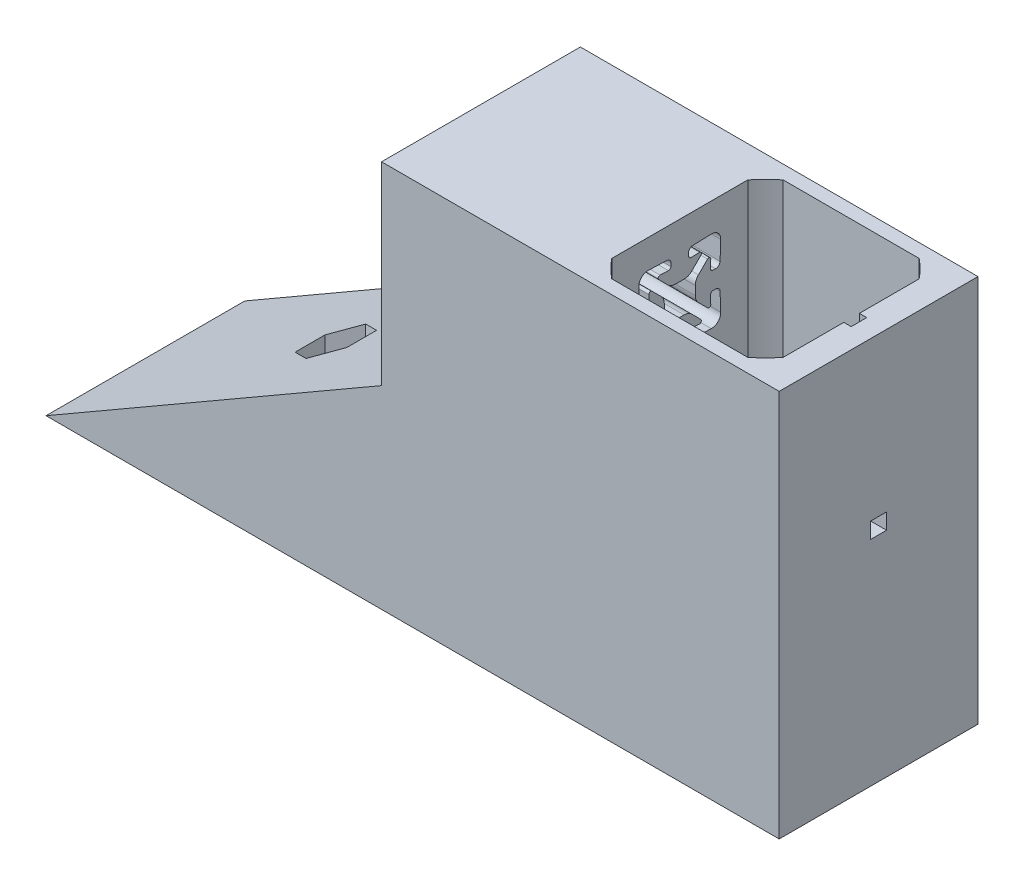
from build123d import *

# Parameters (mm, degrees)
SKETCH1_W           = 35
SKETCH1_H           = 50
SKETCH1_W_2         = 62.5
BOSS_EXTRUDE1_DEPTH = 50
BOSS_EXTRUDE2_DEPTH = 50
CUT_EXTRUDE1_DEPTH  = 81
BOSS_EXTRUDE3_DEPTH = 50.006
SKETCH5_W           = 4
SKETCH5_H           = 4
CUT_EXTRUDE2_DEPTH  = 30
BOSS_EXTRUDE4_DEPTH = 50


with BuildPart() as part:
    # Sketch1 → Boss-Extrude1 (new body)
    # profile 1 of 2: a face of its own
    with BuildSketch(Plane.YZ):
        with Locations((80, 305)):
            Rectangle(SKETCH1_W, SKETCH1_H)
        with BuildLine():
            Line((76.1, 303.897755224), (76.1, 306.102244776))
            ThreePointArc((76.1, 306.102244776), (75.894474738, 307.135490044), (75.309188309, 308.011433085))
            Line((75.309188309, 308.011433085), (73.008308049, 310.312313346))
            ThreePointArc((73.008308049, 310.312313346), (72.488454457, 310.411010634), (72.206097787, 309.963502397))
            Line((72.206097787, 309.963502397), (72.280053987, 307.845673932))
            ThreePointArc((72.280053987, 307.845673932), (72.119231712, 307.415535218), (71.701359189, 307.225099738))
            Line((71.701359189, 307.225099738), (71.00178561, 307.20067009))
            ThreePointArc((71.00178561, 307.20067009), (70.213197967, 307.495510928), (69.864066254, 308.261610554))
            Line((69.864066254, 308.261610554), (69.701401098, 312.919731158))
            ThreePointArc((69.701401098, 312.919731158), (70.373654403, 314.626345597), (72.080268842, 315.298598902))
            Line((72.080268842, 315.298598902), (76.738389446, 315.135933746))
            ThreePointArc((76.738389446, 315.135933746), (77.504489072, 314.786802033), (77.79932991, 313.99821439))
            Line((77.79932991, 313.99821439), (77.774900262, 313.298640811))
            ThreePointArc((77.774900262, 313.298640811), (77.584464782, 312.880768288), (77.154326068, 312.719946013))
            Line((77.154326068, 312.719946013), (75.036497603, 312.793902213))
            ThreePointArc((75.036497603, 312.793902213), (74.588989366, 312.511545543), (74.687686654, 311.991691951))
            Line((74.687686654, 311.991691951), (76.988566915, 309.690811691))
            ThreePointArc((76.988566915, 309.690811691), (77.864509956, 309.105525262), (78.897755224, 308.9))
            Line((78.897755224, 308.9), (81.102244776, 308.9))
            ThreePointArc((81.102244776, 308.9), (82.135490044, 309.105525262), (83.011433085, 309.690811691))
            Line((83.011433085, 309.690811691), (85.312313346, 311.991691951))
            ThreePointArc((85.312313346, 311.991691951), (85.411010634, 312.511545543), (84.963502397, 312.793902213))
            Line((84.963502397, 312.793902213), (82.845673932, 312.719946013))
            ThreePointArc((82.845673932, 312.719946013), (82.415535218, 312.880768288), (82.225099738, 313.298640811))
            Line((82.225099738, 313.298640811), (82.20067009, 313.99821439))
            ThreePointArc((82.20067009, 313.99821439), (82.495510928, 314.786802033), (83.261610554, 315.135933746))
            Line((83.261610554, 315.135933746), (87.919731158, 315.298598902))
            ThreePointArc((87.919731158, 315.298598902), (89.626345597, 314.626345597), (90.298598902, 312.919731158))
            Line((90.298598902, 312.919731158), (90.135933746, 308.261610554))
            ThreePointArc((90.135933746, 308.261610554), (89.786802033, 307.495510928), (88.99821439, 307.20067009))
            Line((88.99821439, 307.20067009), (88.298640811, 307.225099738))
            ThreePointArc((88.298640811, 307.225099738), (87.880768288, 307.415535218), (87.719946013, 307.845673932))
            Line((87.719946013, 307.845673932), (87.793902213, 309.963502397))
            ThreePointArc((87.793902213, 309.963502397), (87.511545543, 310.411010634), (86.991691951, 310.312313346))
            Line((86.991691951, 310.312313346), (84.690811691, 308.011433085))
            ThreePointArc((84.690811691, 308.011433085), (84.105525262, 307.135490044), (83.9, 306.102244776))
            Line((83.9, 306.102244776), (83.9, 303.897755224))
            ThreePointArc((83.9, 303.897755224), (84.105525262, 302.864509956), (84.690811691, 301.988566915))
            Line((84.690811691, 301.988566915), (86.991691951, 299.687686654))
            ThreePointArc((86.991691951, 299.687686654), (87.511545543, 299.588989366), (87.793902213, 300.036497603))
            Line((87.793902213, 300.036497603), (87.719946013, 302.154326068))
            ThreePointArc((87.719946013, 302.154326068), (87.880768288, 302.584464782), (88.298640811, 302.774900262))
            Line((88.298640811, 302.774900262), (88.99821439, 302.79932991))
            ThreePointArc((88.99821439, 302.79932991), (89.786802033, 302.504489072), (90.135933746, 301.738389446))
            Line((90.135933746, 301.738389446), (90.298598902, 297.080268842))
            ThreePointArc((90.298598902, 297.080268842), (89.626345597, 295.373654403), (87.919731158, 294.701401098))
            Line((87.919731158, 294.701401098), (83.261610554, 294.864066254))
            ThreePointArc((83.261610554, 294.864066254), (82.495510928, 295.213197967), (82.20067009, 296.00178561))
            Line((82.20067009, 296.00178561), (82.225099738, 296.701359189))
            ThreePointArc((82.225099738, 296.701359189), (82.415535218, 297.119231712), (82.845673932, 297.280053987))
            Line((82.845673932, 297.280053987), (84.963502397, 297.206097787))
            ThreePointArc((84.963502397, 297.206097787), (85.411010634, 297.488454457), (85.312313346, 298.008308049))
            Line((85.312313346, 298.008308049), (83.011433085, 300.309188309))
            ThreePointArc((83.011433085, 300.309188309), (82.135490044, 300.894474738), (81.102244776, 301.1))
            Line((81.102244776, 301.1), (78.897755224, 301.1))
            ThreePointArc((78.897755224, 301.1), (77.864509956, 300.894474738), (76.988566915, 300.309188309))
            Line((76.988566915, 300.309188309), (74.687686654, 298.008308049))
            ThreePointArc((74.687686654, 298.008308049), (74.588989366, 297.488454457), (75.036497603, 297.206097787))
            Line((75.036497603, 297.206097787), (77.154326068, 297.280053987))
            ThreePointArc((77.154326068, 297.280053987), (77.584464782, 297.119231712), (77.774900262, 296.701359189))
            Line((77.774900262, 296.701359189), (77.79932991, 296.00178561))
            ThreePointArc((77.79932991, 296.00178561), (77.504489072, 295.213197967), (76.738389446, 294.864066254))
            Line((76.738389446, 294.864066254), (72.080268842, 294.701401098))
            ThreePointArc((72.080268842, 294.701401098), (70.373654403, 295.373654403), (69.701401098, 297.080268842))
            Line((69.701401098, 297.080268842), (69.864066254, 301.738389446))
            ThreePointArc((69.864066254, 301.738389446), (70.213197967, 302.504489072), (71.00178561, 302.79932991))
            Line((71.00178561, 302.79932991), (71.701359189, 302.774900262))
            ThreePointArc((71.701359189, 302.774900262), (72.119231712, 302.584464782), (72.280053987, 302.154326068))
            Line((72.280053987, 302.154326068), (72.206097787, 300.036497603))
            ThreePointArc((72.206097787, 300.036497603), (72.488454457, 299.588989366), (73.008308049, 299.687686654))
            Line((73.008308049, 299.687686654), (75.309188309, 301.988566915))
            ThreePointArc((75.309188309, 301.988566915), (75.894474738, 302.864509956), (76.1, 303.897755224))
        make_face(mode=Mode.SUBTRACT)
    # profile 2 of 2: a face of its own
    with BuildSketch(Plane.YZ):
        with Locations((31.25, 305)):
            Rectangle(SKETCH1_W_2, SKETCH1_H)
    extrude(amount=-BOSS_EXTRUDE1_DEPTH)

    # Sketch2 → Boss-Extrude2 (add)
    with BuildSketch(Plane(origin=(0, 0, 280), x_dir=(1, 0, 0), z_dir=(0, 0, -1))):
        Polygon((-50, -48.75), (-134.386033469, 0), (-50, 0), align=None)
    extrude(amount=-BOSS_EXTRUDE2_DEPTH)

    # Sketch3 → Cut-Extrude1 (cut)
    with BuildSketch(Plane(origin=(0, 97.5, 0), x_dir=(-1, 0, 0), z_dir=(0, 1, 0))):
        Polygon((67.990381057, 308.75), (61.495190528, 312.5), (55, 308.75), (55, 301.25), (61.495190528, 297.5), (67.990381057, 301.25), align=None)
        Polygon((92.990381057, 308.75), (86.495190528, 312.5), (80, 308.75), (80, 301.25), (86.495190528, 297.5), (92.990381057, 301.25), align=None)
    extrude(amount=-CUT_EXTRUDE1_DEPTH, mode=Mode.SUBTRACT)

    # Sketch4 → Boss-Extrude3 (add)
    with BuildSketch(Plane.XZ.offset(-47.494)):
        with BuildLine():
            Line((43.1, 322.104760785), (43.1, 306.85548466))
            Line((43.1, 306.85548466), (44.953275281, 306.85548466))
            Line((44.953275281, 306.85548466), (44.953275281, 302.922372887))
            Line((44.953275281, 302.922372887), (43.1, 302.922372887))
            Line((43.1, 302.922372887), (43.1, 287.895239215))
            ThreePointArc((43.1, 287.895239215), (41.005760925, 285.544239075), (38.654760785, 283.45))
            Line((38.654760785, 283.45), (4.445239215, 283.45))
            ThreePointArc((4.445239215, 283.45), (2.094239075, 285.544239075), (0, 287.895239215))
            Line((0, 287.895239215), (0, 280))
            Line((0, 280), (50, 280))
            Line((50, 280), (50, 330))
            Line((50, 330), (0, 330))
            Line((0, 330), (0, 322.104760785))
            ThreePointArc((0, 322.104760785), (2.094239075, 324.455760925), (4.445239215, 326.55))
            Line((4.445239215, 326.55), (38.654760785, 326.55))
            ThreePointArc((38.654760785, 326.55), (41.005760925, 324.455760925), (43.1, 322.104760785))
        make_face()
    extrude(amount=-BOSS_EXTRUDE3_DEPTH)

    # Sketch5 → Cut-Extrude2 (cut)
    with BuildSketch(Plane(origin=(44.953275281, 0, 0), x_dir=(0, -1, 0), z_dir=(-1, 0, 0))):
        with Locations((-55.75, 305)):
            Rectangle(SKETCH5_W, SKETCH5_H)
    extrude(amount=-CUT_EXTRUDE2_DEPTH, mode=Mode.SUBTRACT)

    # Sketch6 → Boss-Extrude4 (add)
    with BuildSketch(Plane.YZ):
        Polygon((0, 280), (47.494, 280), (47.494, 287.895239215), (47.494, 322.104760785), (47.494, 330), (0, 330), align=None)
    extrude(amount=BOSS_EXTRUDE4_DEPTH)


solid = part.part
